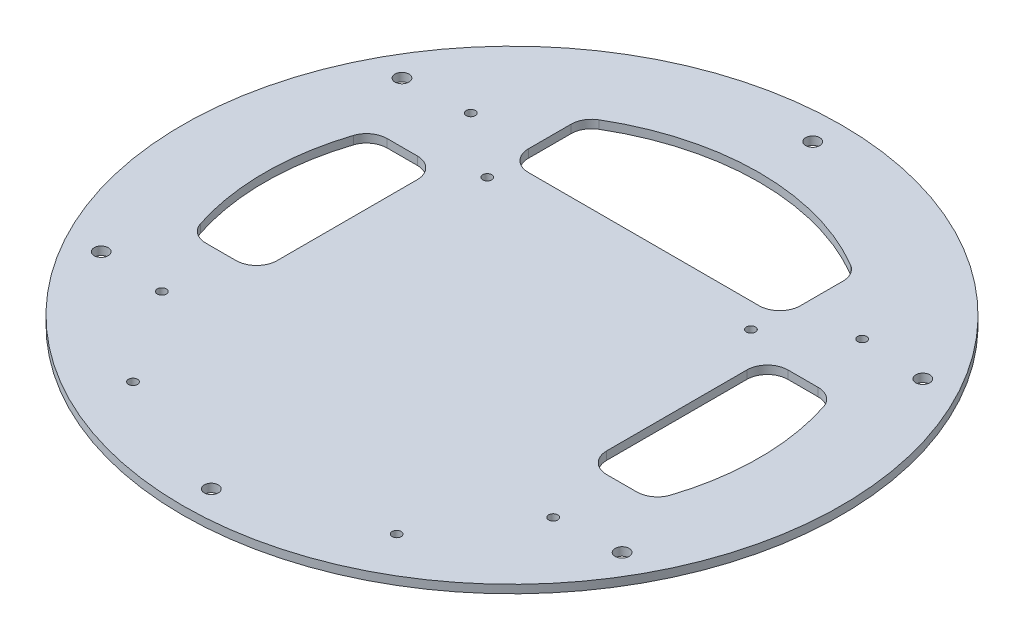
from build123d import *

# Parameters (mm, degrees)
SKETCH_2_R               = 80
EXTRUDE_1_DEPTH          = 2
CUT_EXTRUDE_1_DEPTH      = 114.154761279
CUT_EXTRUDE_1_DEPTH_BACK = 114.154761279
SKETCH_3_R               = 1.1
CUT_EXTRUDE_2_DEPTH      = 114.154761279
CUT_EXTRUDE_3_REACH      = 115.155
SKETCH_5_R               = 1.7


with BuildPart() as part:
    # 草图2 → 凸台-拉伸1 (new body)
    with BuildSketch(Plane(origin=(0, 0, 0), x_dir=(1, 0, 0), z_dir=(0, 1, 0))):
        Circle(SKETCH_2_R)
    extrude(amount=EXTRUDE_1_DEPTH)

    # 草图3 → 切除-拉伸1 (cut, two sides: drawn at the far end of the back side and taken through both)
    with BuildSketch(Plane.XZ.offset(-CUT_EXTRUDE_1_DEPTH_BACK)):
        with Locations((32, 60)):
            Circle(SKETCH_3_R)
        with Locations((-32, 60)):
            Circle(SKETCH_3_R)
        with Locations((-32, -26)):
            Circle(SKETCH_3_R)
        with Locations((32, -26)):
            Circle(SKETCH_3_R)
        with Locations((-47.5, 37.5)):
            Circle(SKETCH_3_R)
        with Locations((47.5, 37.5)):
            Circle(SKETCH_3_R)
        with Locations((47.5, -37.5)):
            Circle(SKETCH_3_R)
        with Locations((-47.5, -37.5)):
            Circle(SKETCH_3_R)
    extrude(amount=CUT_EXTRUDE_1_DEPTH + CUT_EXTRUDE_1_DEPTH_BACK, mode=Mode.SUBTRACT)

    # 草图4 → 切除-拉伸2 (cut, through all)
    with BuildSketch(Plane(origin=(0, 2, 0), x_dir=(1, 0, 0), z_dir=(0, 1, 0))):
        with BuildLine():
            Line((33, 47.339201514), (33, 37))
            ThreePointArc((33, 37), (31.535533906, 33.464466094), (28, 32))
            Line((28, 32), (-28, 32))
            ThreePointArc((-28, 32), (-31.535533906, 33.464466094), (-33, 37))
            Line((-33, 37), (-33, 47.339201514))
            ThreePointArc((-33, 47.339201514), (-32.343228795, 49.816369986), (-30.545454545, 51.642765288))
            ThreePointArc((-30.545454545, 51.642765288), (0, 60), (30.545454545, 51.642765288))
            ThreePointArc((30.545454545, 51.642765288), (32.343228795, 49.816369986), (33, 47.339201514))
        make_face()
        with BuildLine():
            Line((-52.306787322, 22), (-45, 22))
            ThreePointArc((-45, 22), (-41.464466094, 20.535533906), (-40, 17))
            Line((-40, 17), (-40, -17))
            ThreePointArc((-40, -17), (-41.464466094, -20.535533906), (-45, -22))
            Line((-45, -22), (-52.306787322, -22))
            ThreePointArc((-52.306787322, -22), (-55.245556391, -21.045199175), (-57.061949806, -18.545454545))
            ThreePointArc((-57.061949806, -18.545454545), (-60, 0), (-57.061949806, 18.545454545))
            ThreePointArc((-57.061949806, 18.545454545), (-55.245556391, 21.045199175), (-52.306787322, 22))
        make_face()
        with BuildLine():
            Line((52.306787322, -22), (45, -22))
            ThreePointArc((45, -22), (41.464466094, -20.535533906), (40, -17))
            Line((40, -17), (40, 17))
            ThreePointArc((40, 17), (41.464466094, 20.535533906), (45, 22))
            Line((45, 22), (52.306787322, 22))
            ThreePointArc((52.306787322, 22), (55.245556391, 21.045199175), (57.061949806, 18.545454545))
            ThreePointArc((57.061949806, 18.545454545), (60, 0), (57.061949806, -18.545454545))
            ThreePointArc((57.061949806, -18.545454545), (55.245556391, -21.045199175), (52.306787322, -22))
        make_face()
    extrude(amount=-CUT_EXTRUDE_2_DEPTH, mode=Mode.SUBTRACT)

    # 草图5 → 切除-拉伸3 (cut, up to next)
    with BuildSketch(Plane(origin=(0, 2, 0), x_dir=(1, 0, 0), z_dir=(0, 1, 0)), mode=Mode.PRIVATE) as cut_extrude_3_sk1:
        with Locations((0, -73)):
            Circle(SKETCH_5_R)
    cut_extrude_3_tool1 = extrude(cut_extrude_3_sk1.sketch, amount=-CUT_EXTRUDE_3_REACH, mode=Mode.PRIVATE) & part.part
    # 草图5 → 切除-拉伸3 (cut, up to next)
    with BuildSketch(Plane(origin=(0, 2, 0), x_dir=(1, 0, 0), z_dir=(0, 1, 0)), mode=Mode.PRIVATE) as cut_extrude_3_sk2:
        with Locations((-63.219854476, -36.5)):
            Circle(SKETCH_5_R)
    cut_extrude_3_tool2 = extrude(cut_extrude_3_sk2.sketch, amount=-CUT_EXTRUDE_3_REACH, mode=Mode.PRIVATE) & part.part
    # 草图5 → 切除-拉伸3 (cut, up to next)
    with BuildSketch(Plane(origin=(0, 2, 0), x_dir=(1, 0, 0), z_dir=(0, 1, 0)), mode=Mode.PRIVATE) as cut_extrude_3_sk3:
        with Locations((-63.219854476, 36.5)):
            Circle(SKETCH_5_R)
    cut_extrude_3_tool3 = extrude(cut_extrude_3_sk3.sketch, amount=-CUT_EXTRUDE_3_REACH, mode=Mode.PRIVATE) & part.part
    # 草图5 → 切除-拉伸3 (cut, up to next)
    with BuildSketch(Plane(origin=(0, 2, 0), x_dir=(1, 0, 0), z_dir=(0, 1, 0)), mode=Mode.PRIVATE) as cut_extrude_3_sk4:
        with Locations((0, 73)):
            Circle(SKETCH_5_R)
    cut_extrude_3_tool4 = extrude(cut_extrude_3_sk4.sketch, amount=-CUT_EXTRUDE_3_REACH, mode=Mode.PRIVATE) & part.part
    # 草图5 → 切除-拉伸3 (cut, up to next)
    with BuildSketch(Plane(origin=(0, 2, 0), x_dir=(1, 0, 0), z_dir=(0, 1, 0)), mode=Mode.PRIVATE) as cut_extrude_3_sk5:
        with Locations((63.219854476, 36.5)):
            Circle(SKETCH_5_R)
    cut_extrude_3_tool5 = extrude(cut_extrude_3_sk5.sketch, amount=-CUT_EXTRUDE_3_REACH, mode=Mode.PRIVATE) & part.part
    # 草图5 → 切除-拉伸3 (cut, up to next)
    with BuildSketch(Plane(origin=(0, 2, 0), x_dir=(1, 0, 0), z_dir=(0, 1, 0)), mode=Mode.PRIVATE) as cut_extrude_3_sk6:
        with Locations((63.219854476, -36.5)):
            Circle(SKETCH_5_R)
    cut_extrude_3_tool6 = extrude(cut_extrude_3_sk6.sketch, amount=-CUT_EXTRUDE_3_REACH, mode=Mode.PRIVATE) & part.part
    add(cut_extrude_3_tool1.solids().sort_by_distance((0, 2, 73))[0], mode=Mode.SUBTRACT)
    add(cut_extrude_3_tool2.solids().sort_by_distance((-63.219854, 2, 36.5))[0], mode=Mode.SUBTRACT)
    add(cut_extrude_3_tool3.solids().sort_by_distance((-63.219854, 2, -36.5))[0], mode=Mode.SUBTRACT)
    add(cut_extrude_3_tool4.solids().sort_by_distance((0, 2, -73))[0], mode=Mode.SUBTRACT)
    add(cut_extrude_3_tool5.solids().sort_by_distance((63.219854, 2, -36.5))[0], mode=Mode.SUBTRACT)
    add(cut_extrude_3_tool6.solids().sort_by_distance((63.219854, 2, 36.5))[0], mode=Mode.SUBTRACT)


solid = part.part
